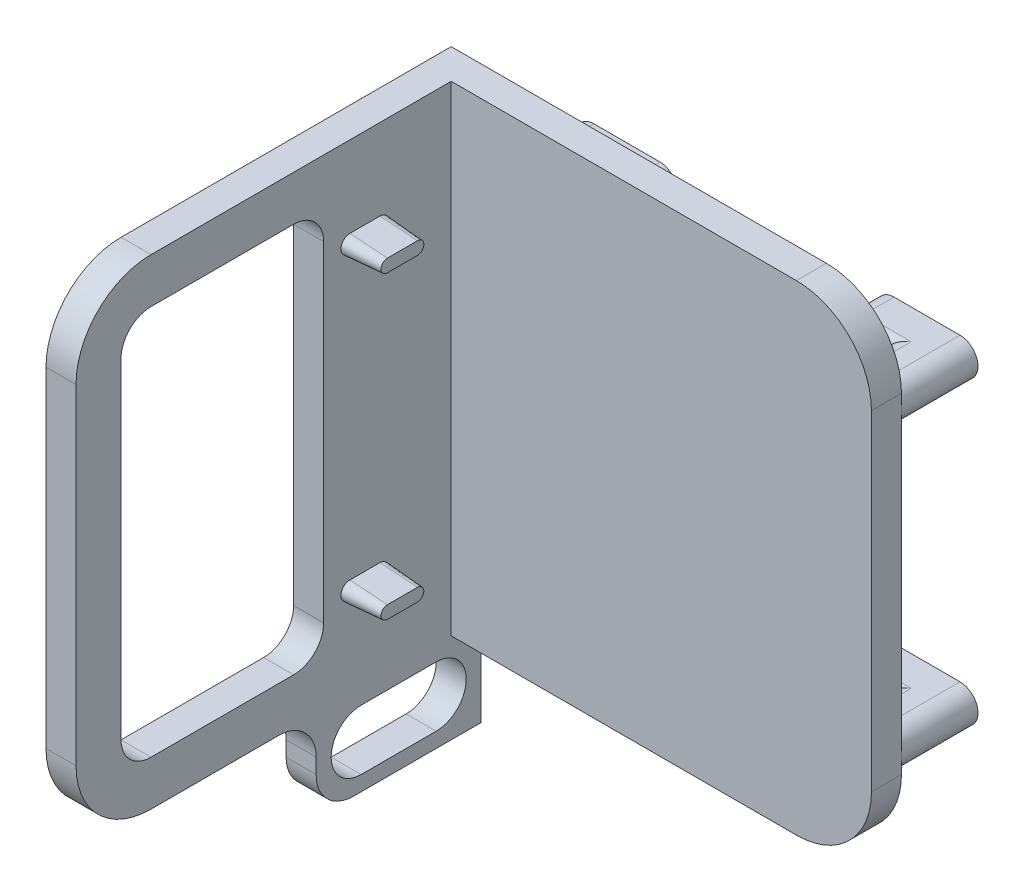
from build123d import *

# Parameters (mm, degrees)
SKETCH_1_W                = 60
SKETCH_1_H                = 4
EXTRUDE_1_DEPTH           = 64
SKETCH_2_W                = 4
SKETCH_2_H                = 64
EXTRUDE_2_DEPTH           = 50
FILLET_1_R                = 10
CUT_EXTRUDE_1_REACH       = 92.324
SKETCH_4_W                = 11
SKETCH_4_H                = 52
EXTRUDE_3_DEPTH           = 4
EXTRUDE_4_DEPTH           = 5
EXTRUDE_4_DRAFT           = 4
EXTRUDE_4_PROFILE_2_DEPTH = 5
EXTRUDE_4_PROFILE_2_DRAFT = 4
FILLET_2_R                = 4
EXTRUDE_5_DEPTH           = 5.2
EXTRUDE_6_DEPTH           = 5
FILLET_3_R                = 1
SKETCH_8_W                = 4
SKETCH_8_H                = 22
EXTRUDE_7_DEPTH           = 12
FILLET_4_R                = 5
CUT_EXTRUDE_2_REACH       = 96.252


with BuildPart() as part:
    # 草图1 → 凸台-拉伸1 (new body)
    with BuildSketch(Plane(origin=(0, 0, 0), x_dir=(1, 0, 0), z_dir=(0, 1, 0))):
        with Locations((-88.556547212, 28.436915988)):
            Rectangle(SKETCH_1_W, SKETCH_1_H)
    extrude(amount=EXTRUDE_1_DEPTH)

    # 草图2 → 凸台-拉伸2 (add)
    with BuildSketch(Plane.XY.offset(-26.436915988)):
        with Locations((-116.556547212, 32)):
            Rectangle(SKETCH_2_W, SKETCH_2_H)
    extrude(amount=EXTRUDE_2_DEPTH)

    # 圆角1
    fillet_1_edges = [part.edges().sort_by_distance(p)[0] for p in [
        (-58.556547212, 0, -28.436915988),
        (-58.556547212, 64, -28.436915988),
        (-116.556547212, 0, 23.563084012),
        (-116.556547212, 64, 23.563084012),
    ]]
    fillet(fillet_1_edges, radius=FILLET_1_R)

    # 草图3 → 切除-拉伸1 (cut, up to next)
    with BuildSketch(Plane(origin=(-114.556547212, 0, 0), x_dir=(0, 0, -1), z_dir=(1, 0, 0)), mode=Mode.PRIVATE) as cut_extrude_1_sk1:
        with BuildLine():
            Line((-17.563084012, 54), (-17.563084012, 10))
            ThreePointArc((-17.563084012, 10), (-16.391511137, 7.171572875), (-13.563084012, 6))
            Line((-13.563084012, 6), (20.436915988, 6))
            Line((20.436915988, 6), (20.436915988, 58))
            Line((20.436915988, 58), (-13.563084012, 58))
            ThreePointArc((-13.563084012, 58), (-16.391511137, 56.828427125), (-17.563084012, 54))
        make_face()
    cut_extrude_1_tool1 = extrude(cut_extrude_1_sk1.sketch, amount=-CUT_EXTRUDE_1_REACH, mode=Mode.PRIVATE) & part.part
    add(cut_extrude_1_tool1.solids().sort_by_distance((-114.556547, 32, -1.500062))[0], mode=Mode.SUBTRACT)


with BuildPart() as body_2:
    # 草图4 → 凸台-拉伸3 (new body)
    with BuildSketch(Plane.ZY.offset(118.556547212)):
        with Locations((-14.936915988, 32)):
            Rectangle(SKETCH_4_W, SKETCH_4_H)
    extrude(amount=-EXTRUDE_3_DEPTH)


with BuildPart() as extrude_4_tool:
    # 草图5 → 凸台-拉伸4 (with draft: the straight prism first)
    with BuildSketch(Plane(origin=(-114.556547212, 0, 0), x_dir=(0, 0, -1), z_dir=(1, 0, 0))):
        with BuildLine():
            ThreePointArc((12.936915988, 53.2), (11.736915988, 52), (12.936915988, 50.8))
            Line((12.936915988, 50.8), (16.936915988, 50.8))
            ThreePointArc((16.936915988, 50.8), (18.136915988, 52), (16.936915988, 53.2))
            Line((16.936915988, 53.2), (12.936915988, 53.2))
        make_face()
    extrude(amount=EXTRUDE_4_DEPTH)
    # 凸台-拉伸4: the draft: its side faces are tilted about the plane it starts from
    extrude_4_sides = [extrude_4_tool.faces().sort_by_distance(p)[0] for p in [
        (-112.056547212, 52, -18.136915988),
        (-112.056547212, 53.2, -14.936915988),
        (-112.056547212, 52, -11.736915988),
        (-112.056547212, 50.8, -14.936915988),
    ]]
    draft(extrude_4_sides, Plane(origin=(-114.556547212, 0, 0), x_dir=(0, 0, -1), z_dir=(1, 0, 0)), EXTRUDE_4_DRAFT)


with BuildPart() as part_1:
    add(part.part)

    # 凸台-拉伸4: add extrude_4_tool
    add(extrude_4_tool.part)

    add(body_2.part)  # 凸台-拉伸4 merges body 2


with BuildPart() as extrude_4_profile_2_tool:
    # 草图5 → 凸台-拉伸4 profile 2 (with draft: the straight prism first)
    with BuildSketch(Plane(origin=(-114.556547212, 0, 0), x_dir=(0, 0, -1), z_dir=(1, 0, 0))):
        with BuildLine():
            ThreePointArc((12.936915988, 13.2), (11.736915988, 12), (12.936915988, 10.8))
            Line((12.936915988, 10.8), (16.936915988, 10.8))
            ThreePointArc((16.936915988, 10.8), (18.136915988, 12), (16.936915988, 13.2))
            Line((16.936915988, 13.2), (12.936915988, 13.2))
        make_face()
    extrude(amount=EXTRUDE_4_PROFILE_2_DEPTH)
    # 凸台-拉伸4 profile 2: the draft: its side faces are tilted about the plane it starts from
    extrude_4_profile_2_sides = [extrude_4_profile_2_tool.faces().sort_by_distance(p)[0] for p in [
        (-112.056547212, 12, -11.736915988),
        (-112.056547212, 10.8, -14.936915988),
        (-112.056547212, 12, -18.136915988),
        (-112.056547212, 13.2, -14.936915988),
    ]]
    draft(extrude_4_profile_2_sides, Plane(origin=(-114.556547212, 0, 0), x_dir=(0, 0, -1), z_dir=(1, 0, 0)), EXTRUDE_4_PROFILE_2_DRAFT)


with BuildPart() as part_2:
    add(part_1.part)

    # 凸台-拉伸4 profile 2: add extrude_4_profile_2_tool
    add(extrude_4_profile_2_tool.part)

    # 圆角2
    fillet_2_edges = [part_2.edges().sort_by_distance(p)[0] for p in [
        (-116.556547212, 58, -9.436915988),
        (-116.556547212, 6, -9.436915988),
    ]]
    fillet(fillet_2_edges, radius=FILLET_2_R)

    # 草图6 → 凸台-拉伸5 (add)
    with BuildSketch(Plane(origin=(0, 0, -30.436915988), x_dir=(-1, 0, 0), z_dir=(0, 0, -1))):
        with BuildLine():
            Line((60.956547212, 54.4), (63.456547212, 54.4))
            ThreePointArc((63.456547212, 54.4), (65.856547212, 52), (63.456547212, 49.6))
            Line((63.456547212, 49.6), (60.956547212, 49.6))
            ThreePointArc((60.956547212, 49.6), (58.556547212, 52), (60.956547212, 54.4))
        make_face()
        with BuildLine():
            Line((100.956547212, 54.4), (103.456547212, 54.4))
            ThreePointArc((103.456547212, 54.4), (105.856547212, 52), (103.456547212, 49.6))
            Line((103.456547212, 49.6), (100.956547212, 49.6))
            ThreePointArc((100.956547212, 49.6), (98.556547212, 52), (100.956547212, 54.4))
        make_face()
        with BuildLine():
            Line((100.956547212, 14.4), (103.456547212, 14.4))
            ThreePointArc((103.456547212, 14.4), (105.856547212, 12), (103.456547212, 9.6))
            Line((103.456547212, 9.6), (100.956547212, 9.6))
            ThreePointArc((100.956547212, 9.6), (98.556547212, 12), (100.956547212, 14.4))
        make_face()
        with BuildLine():
            Line((60.956547212, 14.4), (63.456547212, 14.4))
            ThreePointArc((63.456547212, 14.4), (65.856547212, 12), (63.456547212, 9.6))
            Line((63.456547212, 9.6), (60.956547212, 9.6))
            ThreePointArc((60.956547212, 9.6), (58.556547212, 12), (60.956547212, 14.4))
        make_face()
    extrude(amount=EXTRUDE_5_DEPTH)

    # 草图7 → 凸台-拉伸6 (add)
    with BuildSketch(Plane(origin=(0, 0, -35.636915988), x_dir=(-1, 0, 0), z_dir=(0, 0, -1))):
        with BuildLine():
            Line((60.956547212, 54.4), (69.756547212, 54.4))
            ThreePointArc((69.756547212, 54.4), (72.156547212, 52), (69.756547212, 49.6))
            Line((69.756547212, 49.6), (60.956547212, 49.6))
            ThreePointArc((60.956547212, 49.6), (58.556547212, 52), (60.956547212, 54.4))
        make_face()
        with BuildLine():
            Line((100.956547212, 54.4), (109.756547212, 54.4))
            ThreePointArc((109.756547212, 54.4), (112.156547212, 52), (109.756547212, 49.6))
            Line((109.756547212, 49.6), (100.956547212, 49.6))
            ThreePointArc((100.956547212, 49.6), (98.556547212, 52), (100.956547212, 54.4))
        make_face()
        with BuildLine():
            Line((100.956547212, 14.4), (109.756547212, 14.4))
            ThreePointArc((109.756547212, 14.4), (112.156547212, 12), (109.756547212, 9.6))
            Line((109.756547212, 9.6), (100.956547212, 9.6))
            ThreePointArc((100.956547212, 9.6), (98.556547212, 12), (100.956547212, 14.4))
        make_face()
        with BuildLine():
            Line((60.956547212, 14.4), (69.756547212, 14.4))
            ThreePointArc((69.756547212, 14.4), (72.156547212, 12), (69.756547212, 9.6))
            Line((69.756547212, 9.6), (60.956547212, 9.6))
            ThreePointArc((60.956547212, 9.6), (58.556547212, 12), (60.956547212, 14.4))
        make_face()
    extrude(amount=EXTRUDE_6_DEPTH)

    # 圆角3
    fillet_3_edges = [part_2.edges().sort_by_distance(p)[0] for p in [
        (-66.606547212, 49.6, -35.636915988),
        (-66.606547212, 54.4, -35.636915988),
        (-66.606547212, 9.6, -35.636915988),
        (-66.606547212, 14.4, -35.636915988),
        (-106.606547212, 9.6, -35.636915988),
        (-106.606547212, 14.4, -35.636915988),
        (-106.606547212, 49.6, -35.636915988),
        (-106.606547212, 54.4, -35.636915988),
        (-72.156547212, 52, -35.636915988),
        (-72.156547212, 12, -35.636915988),
        (-112.156547212, 12, -35.636915988),
        (-112.156547212, 52, -35.636915988),
    ]]
    fillet(fillet_3_edges, radius=FILLET_3_R)

    # 草图8 → 凸台-拉伸7 (add)
    with BuildSketch(Plane.XZ):
        with Locations((-116.556547212, -19.436915988)):
            Rectangle(SKETCH_8_W, SKETCH_8_H)
    extrude(amount=EXTRUDE_7_DEPTH)

    # 圆角4
    fillet_4_edges = [part_2.edges().sort_by_distance(p)[0] for p in [
        (-116.556547212, 0, -8.436915988),
        (-116.556547212, -12, -8.436915988),
    ]]
    fillet(fillet_4_edges, radius=FILLET_4_R)

    # 草图9 → 切除-拉伸2 (cut, up to next)
    with BuildSketch(Plane(origin=(-114.556547212, 0, 0), x_dir=(0, 0, -1), z_dir=(1, 0, 0)), mode=Mode.PRIVATE) as cut_extrude_2_sk1:
        with BuildLine():
            Line((14.436915988, -2), (24.436915988, -2))
            ThreePointArc((24.436915988, -2), (28.436915988, -6), (24.436915988, -10))
            Line((24.436915988, -10), (14.436915988, -10))
            ThreePointArc((14.436915988, -10), (10.436915988, -6), (14.436915988, -2))
        make_face()
    cut_extrude_2_tool1 = extrude(cut_extrude_2_sk1.sketch, amount=-CUT_EXTRUDE_2_REACH, mode=Mode.PRIVATE) & part_2.part
    add(cut_extrude_2_tool1.solids().sort_by_distance((-114.556547, -6, -19.436916))[0], mode=Mode.SUBTRACT)


solid = part_2.part
